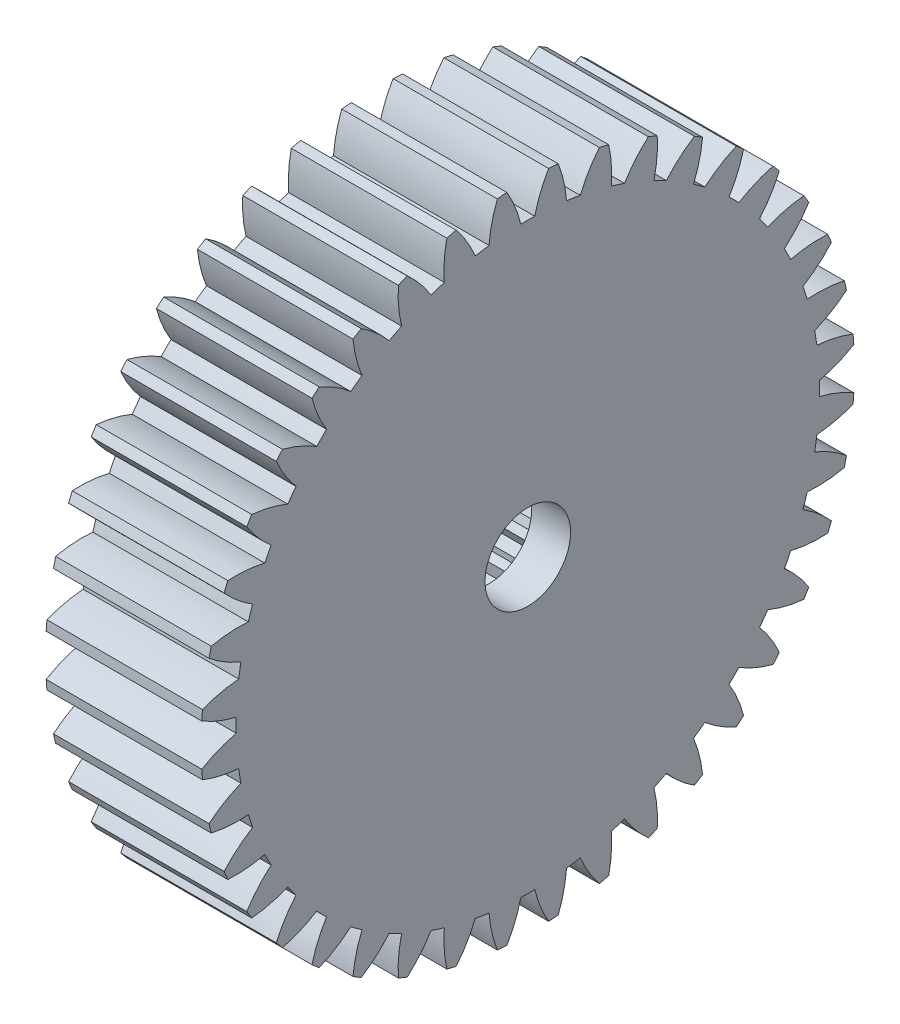
from build123d import *

# Parameters (mm, degrees)
SKETCH1_R           = 0.4
BOSS_EXTRUDE1_DEPTH = 3
CUT_EXTRUDE1_DEPTH  = 13.228899958
SKETCH4_R           = 2.15
CUT_EXTRUDE2_DEPTH  = 13.22890012
BOSS_EXTRUDE2_START = 1
BOSS_EXTRUDE2_DEPTH = 1
SKETCH6_R           = 1.1
CUT_EXTRUDE4_DEPTH  = 13.228900267


with BuildPart() as part:
    # Sketch1 → Boss-Extrude1 (new body)
    with BuildSketch(Plane(origin=(-1.595003587, 0, 0), x_dir=(0, 0, -1), z_dir=(1, 0, 0))):
        with BuildLine():
            ThreePointArc((-8.382899086, 0.535726523), (-7.953265869, 0.324118302), (-7.496863358, 0.178999427))
            ThreePointArc((-7.496863358, 0.178999427), (-7.499, 0), (-7.496863358, -0.178999427))
            ThreePointArc((-7.496863358, -0.178999427), (-7.953265869, -0.324118302), (-8.382899086, -0.535726523))
            ThreePointArc((-8.382899086, -0.535726523), (-8.374105603, -0.659056404), (-8.36349778, -0.782243493))
            ThreePointArc((-8.36349778, -0.782243493), (-7.906051242, -0.924037024), (-7.432566209, -0.995972162))
            ThreePointArc((-7.432566209, -0.995972162), (-7.406674866, -1.173102053), (-7.37656285, -1.349563456))
            ThreePointArc((-7.37656285, -1.349563456), (-7.804644696, -1.564292759), (-8.195885596, -1.840505175))
            ThreePointArc((-8.195885596, -1.840505175), (-8.167907331, -1.960941056), (-8.138159402, -2.080952079))
            ThreePointArc((-8.138159402, -2.080952079), (-7.664163394, -2.149439492), (-7.185254613, -2.146419611))
            ThreePointArc((-7.185254613, -2.146419611), (-7.131972816, -2.317318441), (-7.074626883, -2.486896753))
            ThreePointArc((-7.074626883, -2.486896753), (-7.463847268, -2.765949137), (-7.807062202, -3.099964481))
            ThreePointArc((-7.807062202, -3.099964481), (-7.760588073, -3.214540832), (-7.71243253, -3.328420718))
            ThreePointArc((-7.71243253, -3.328420718), (-7.233558408, -3.321915625), (-6.761018202, -3.244015085))
            ThreePointArc((-6.761018202, -3.244015085), (-6.681657925, -3.404474758), (-6.598490123, -3.562994399))
            ThreePointArc((-6.598490123, -3.562994399), (-6.939265149, -3.899498668), (-7.226003026, -4.283092373))
            ThreePointArc((-7.226003026, -4.283092373), (-7.162177381, -4.388987944), (-7.096799973, -4.493932593))
            ThreePointArc((-7.096799973, -4.493932593), (-6.624839207, -4.412595171), (-6.170303084, -4.261732142))
            ThreePointArc((-6.170303084, -4.261732142), (-6.066818441, -4.407801607), (-5.959876638, -4.551359298))
            ThreePointArc((-5.959876638, -4.551359298), (-6.243815291, -4.9370296), (-6.467015673, -5.360756316))
            ThreePointArc((-6.467015673, -5.360756316), (-6.387410111, -5.455363606), (-6.306420647, -5.548788933))
            ThreePointArc((-6.306420647, -5.548788933), (-5.852994478, -5.39462198), (-5.427654626, -5.174511209))
            ThreePointArc((-5.427654626, -5.174511209), (-5.302593752, -5.302593752), (-5.174511209, -5.427654626))
            ThreePointArc((-5.174511209, -5.427654626), (-5.39462198, -5.852994478), (-5.548788933, -6.306420647))
            ThreePointArc((-5.548788933, -6.306420647), (-5.455363606, -6.387410111), (-5.360756316, -6.467015673))
            ThreePointArc((-5.360756316, -6.467015673), (-4.9370296, -6.243815291), (-4.551359298, -5.959876638))
            ThreePointArc((-4.551359298, -5.959876638), (-4.407801607, -6.066818441), (-4.261732142, -6.170303084))
            ThreePointArc((-4.261732142, -6.170303084), (-4.412595171, -6.624839207), (-4.493932593, -7.096799973))
            ThreePointArc((-4.493932593, -7.096799973), (-4.388987944, -7.162177381), (-4.283092373, -7.226003026))
            ThreePointArc((-4.283092373, -7.226003026), (-3.899498668, -6.939265149), (-3.562994399, -6.598490123))
            ThreePointArc((-3.562994399, -6.598490123), (-3.404474758, -6.681657925), (-3.244015085, -6.761018202))
            ThreePointArc((-3.244015085, -6.761018202), (-3.321915625, -7.233558408), (-3.328420718, -7.71243253))
            ThreePointArc((-3.328420718, -7.71243253), (-3.214540832, -7.760588073), (-3.099964481, -7.807062202))
            ThreePointArc((-3.099964481, -7.807062202), (-2.765949137, -7.463847268), (-2.486896753, -7.074626883))
            ThreePointArc((-2.486896753, -7.074626883), (-2.317318441, -7.131972816), (-2.146419611, -7.185254613))
            ThreePointArc((-2.146419611, -7.185254613), (-2.149439492, -7.664163394), (-2.080952079, -8.138159402))
            ThreePointArc((-2.080952079, -8.138159402), (-1.960941056, -8.167907331), (-1.840505175, -8.195885596))
            ThreePointArc((-1.840505175, -8.195885596), (-1.564292759, -7.804644696), (-1.349563456, -7.37656285))
            ThreePointArc((-1.349563456, -7.37656285), (-1.173102053, -7.406674866), (-0.995972162, -7.432566209))
            ThreePointArc((-0.995972162, -7.432566209), (-0.924037024, -7.906051242), (-0.782243493, -8.36349778))
            ThreePointArc((-0.782243493, -8.36349778), (-0.659056404, -8.374105603), (-0.535726523, -8.382899086))
            ThreePointArc((-0.535726523, -8.382899086), (-0.324118302, -7.953265869), (-0.178999427, -7.496863358))
            ThreePointArc((-0.178999427, -7.496863358), (0, -7.499), (0.178999427, -7.496863358))
            ThreePointArc((0.178999427, -7.496863358), (0.324118302, -7.953265869), (0.535726523, -8.382899086))
            ThreePointArc((0.535726523, -8.382899086), (0.659056404, -8.374105603), (0.782243493, -8.36349778))
            ThreePointArc((0.782243493, -8.36349778), (0.924037024, -7.906051242), (0.995972162, -7.432566209))
            ThreePointArc((0.995972162, -7.432566209), (1.173102053, -7.406674866), (1.349563456, -7.37656285))
            ThreePointArc((1.349563456, -7.37656285), (1.564292759, -7.804644696), (1.840505175, -8.195885596))
            ThreePointArc((1.840505175, -8.195885596), (1.960941056, -8.167907331), (2.080952079, -8.138159402))
            ThreePointArc((2.080952079, -8.138159402), (2.149439492, -7.664163394), (2.146419611, -7.185254613))
            ThreePointArc((2.146419611, -7.185254613), (2.317318441, -7.131972816), (2.486896753, -7.074626883))
            ThreePointArc((2.486896753, -7.074626883), (2.765949137, -7.463847268), (3.099964481, -7.807062202))
            ThreePointArc((3.099964481, -7.807062202), (3.214540832, -7.760588073), (3.328420718, -7.71243253))
            ThreePointArc((3.328420718, -7.71243253), (3.321915625, -7.233558408), (3.244015085, -6.761018202))
            ThreePointArc((3.244015085, -6.761018202), (3.404474758, -6.681657925), (3.562994399, -6.598490123))
            ThreePointArc((3.562994399, -6.598490123), (3.899498668, -6.939265149), (4.283092373, -7.226003026))
            ThreePointArc((4.283092373, -7.226003026), (4.388987944, -7.162177381), (4.493932593, -7.096799973))
            ThreePointArc((4.493932593, -7.096799973), (4.412595171, -6.624839207), (4.261732142, -6.170303084))
            ThreePointArc((4.261732142, -6.170303084), (4.407801607, -6.066818441), (4.551359298, -5.959876638))
            ThreePointArc((4.551359298, -5.959876638), (4.9370296, -6.243815291), (5.360756316, -6.467015673))
            ThreePointArc((5.360756316, -6.467015673), (5.455363606, -6.387410111), (5.548788933, -6.306420647))
            ThreePointArc((5.548788933, -6.306420647), (5.39462198, -5.852994478), (5.174511209, -5.427654626))
            ThreePointArc((5.174511209, -5.427654626), (5.302593752, -5.302593752), (5.427654626, -5.174511209))
            ThreePointArc((5.427654626, -5.174511209), (5.852994478, -5.39462198), (6.306420647, -5.548788933))
            ThreePointArc((6.306420647, -5.548788933), (6.387410111, -5.455363606), (6.467015673, -5.360756316))
            ThreePointArc((6.467015673, -5.360756316), (6.243815291, -4.9370296), (5.959876638, -4.551359298))
            ThreePointArc((5.959876638, -4.551359298), (6.066818441, -4.407801607), (6.170303084, -4.261732142))
            ThreePointArc((6.170303084, -4.261732142), (6.624839207, -4.412595171), (7.096799973, -4.493932593))
            ThreePointArc((7.096799973, -4.493932593), (7.162177381, -4.388987944), (7.226003026, -4.283092373))
            ThreePointArc((7.226003026, -4.283092373), (6.939265149, -3.899498668), (6.598490123, -3.562994399))
            ThreePointArc((6.598490123, -3.562994399), (6.681657925, -3.404474758), (6.761018202, -3.244015085))
            ThreePointArc((6.761018202, -3.244015085), (7.233558408, -3.321915625), (7.71243253, -3.328420718))
            ThreePointArc((7.71243253, -3.328420718), (7.760588073, -3.214540832), (7.807062202, -3.099964481))
            ThreePointArc((7.807062202, -3.099964481), (7.463847268, -2.765949137), (7.074626883, -2.486896753))
            ThreePointArc((7.074626883, -2.486896753), (7.131972816, -2.317318441), (7.185254613, -2.146419611))
            ThreePointArc((7.185254613, -2.146419611), (7.664163394, -2.149439492), (8.138159402, -2.080952079))
            ThreePointArc((8.138159402, -2.080952079), (8.167907331, -1.960941056), (8.195885596, -1.840505175))
            ThreePointArc((8.195885596, -1.840505175), (7.804644696, -1.564292759), (7.37656285, -1.349563456))
            ThreePointArc((7.37656285, -1.349563456), (7.406674866, -1.173102053), (7.432566209, -0.995972162))
            ThreePointArc((7.432566209, -0.995972162), (7.906051242, -0.924037024), (8.36349778, -0.782243493))
            ThreePointArc((8.36349778, -0.782243493), (8.374105603, -0.659056404), (8.382899086, -0.535726523))
            ThreePointArc((8.382899086, -0.535726523), (7.953265869, -0.324118302), (7.496863358, -0.178999427))
            ThreePointArc((7.496863358, -0.178999427), (7.499, 0), (7.496863358, 0.178999427))
            ThreePointArc((7.496863358, 0.178999427), (7.953265869, 0.324118302), (8.382899086, 0.535726523))
            ThreePointArc((8.382899086, 0.535726523), (8.374105603, 0.659056404), (8.36349778, 0.782243493))
            ThreePointArc((8.36349778, 0.782243493), (7.906051242, 0.924037024), (7.432566209, 0.995972162))
            ThreePointArc((7.432566209, 0.995972162), (7.406674866, 1.173102053), (7.37656285, 1.349563456))
            ThreePointArc((7.37656285, 1.349563456), (7.804644696, 1.564292759), (8.195885596, 1.840505175))
            ThreePointArc((8.195885596, 1.840505175), (8.167907331, 1.960941056), (8.138159402, 2.080952079))
            ThreePointArc((8.138159402, 2.080952079), (7.664163394, 2.149439492), (7.185254613, 2.146419611))
            ThreePointArc((7.185254613, 2.146419611), (7.131972816, 2.317318441), (7.074626883, 2.486896753))
            ThreePointArc((7.074626883, 2.486896753), (7.463847268, 2.765949137), (7.807062202, 3.099964481))
            ThreePointArc((7.807062202, 3.099964481), (7.760588073, 3.214540832), (7.71243253, 3.328420718))
            ThreePointArc((7.71243253, 3.328420718), (7.233558408, 3.321915625), (6.761018202, 3.244015085))
            ThreePointArc((6.761018202, 3.244015085), (6.681657925, 3.404474758), (6.598490123, 3.562994399))
            ThreePointArc((6.598490123, 3.562994399), (6.939265149, 3.899498668), (7.226003026, 4.283092373))
            ThreePointArc((7.226003026, 4.283092373), (7.162177381, 4.388987944), (7.096799973, 4.493932593))
            ThreePointArc((7.096799973, 4.493932593), (6.624839207, 4.412595171), (6.170303084, 4.261732142))
            ThreePointArc((6.170303084, 4.261732142), (6.066818441, 4.407801607), (5.959876638, 4.551359298))
            ThreePointArc((5.959876638, 4.551359298), (6.243815291, 4.9370296), (6.467015673, 5.360756316))
            ThreePointArc((6.467015673, 5.360756316), (6.387410111, 5.455363606), (6.306420647, 5.548788933))
            ThreePointArc((6.306420647, 5.548788933), (5.852994478, 5.39462198), (5.427654626, 5.174511209))
            ThreePointArc((5.427654626, 5.174511209), (5.302593752, 5.302593752), (5.174511209, 5.427654626))
            ThreePointArc((5.174511209, 5.427654626), (5.39462198, 5.852994478), (5.548788933, 6.306420647))
            ThreePointArc((5.548788933, 6.306420647), (5.455363606, 6.387410111), (5.360756316, 6.467015673))
            ThreePointArc((5.360756316, 6.467015673), (4.9370296, 6.243815291), (4.551359298, 5.959876638))
            ThreePointArc((4.551359298, 5.959876638), (4.407801607, 6.066818441), (4.261732142, 6.170303084))
            ThreePointArc((4.261732142, 6.170303084), (4.412595171, 6.624839207), (4.493932593, 7.096799973))
            ThreePointArc((4.493932593, 7.096799973), (4.388987944, 7.162177381), (4.283092373, 7.226003026))
            ThreePointArc((4.283092373, 7.226003026), (3.899498668, 6.939265149), (3.562994399, 6.598490123))
            ThreePointArc((3.562994399, 6.598490123), (3.404474758, 6.681657925), (3.244015085, 6.761018202))
            ThreePointArc((3.244015085, 6.761018202), (3.321915625, 7.233558408), (3.328420718, 7.71243253))
            ThreePointArc((3.328420718, 7.71243253), (3.214540832, 7.760588073), (3.099964481, 7.807062202))
            ThreePointArc((3.099964481, 7.807062202), (2.765949137, 7.463847268), (2.486896753, 7.074626883))
            ThreePointArc((2.486896753, 7.074626883), (2.317318441, 7.131972816), (2.146419611, 7.185254613))
            ThreePointArc((2.146419611, 7.185254613), (2.149439492, 7.664163394), (2.080952079, 8.138159402))
            ThreePointArc((2.080952079, 8.138159402), (1.960941056, 8.167907331), (1.840505175, 8.195885596))
            ThreePointArc((1.840505175, 8.195885596), (1.564292759, 7.804644696), (1.349563456, 7.37656285))
            ThreePointArc((1.349563456, 7.37656285), (1.173102053, 7.406674866), (0.995972162, 7.432566209))
            ThreePointArc((0.995972162, 7.432566209), (0.924037024, 7.906051242), (0.782243493, 8.36349778))
            ThreePointArc((0.782243493, 8.36349778), (0.659056404, 8.374105603), (0.535726523, 8.382899086))
            ThreePointArc((0.535726523, 8.382899086), (0.324118302, 7.953265869), (0.178999427, 7.496863358))
            ThreePointArc((0.178999427, 7.496863358), (0, 7.499), (-0.178999427, 7.496863358))
            ThreePointArc((-0.178999427, 7.496863358), (-0.324118302, 7.953265869), (-0.535726523, 8.382899086))
            ThreePointArc((-0.535726523, 8.382899086), (-0.659056404, 8.374105603), (-0.782243493, 8.36349778))
            ThreePointArc((-0.782243493, 8.36349778), (-0.924037024, 7.906051242), (-0.995972162, 7.432566209))
            ThreePointArc((-0.995972162, 7.432566209), (-1.173102053, 7.406674866), (-1.349563456, 7.37656285))
            ThreePointArc((-1.349563456, 7.37656285), (-1.564292759, 7.804644696), (-1.840505175, 8.195885596))
            ThreePointArc((-1.840505175, 8.195885596), (-1.960941056, 8.167907331), (-2.080952079, 8.138159402))
            ThreePointArc((-2.080952079, 8.138159402), (-2.149439492, 7.664163394), (-2.146419611, 7.185254613))
            ThreePointArc((-2.146419611, 7.185254613), (-2.317318441, 7.131972816), (-2.486896753, 7.074626883))
            ThreePointArc((-2.486896753, 7.074626883), (-2.765949137, 7.463847268), (-3.099964481, 7.807062202))
            ThreePointArc((-3.099964481, 7.807062202), (-3.214540832, 7.760588073), (-3.328420718, 7.71243253))
            ThreePointArc((-3.328420718, 7.71243253), (-3.321915625, 7.233558408), (-3.244015085, 6.761018202))
            ThreePointArc((-3.244015085, 6.761018202), (-3.404474758, 6.681657925), (-3.562994399, 6.598490123))
            ThreePointArc((-3.562994399, 6.598490123), (-3.899498668, 6.939265149), (-4.283092373, 7.226003026))
            ThreePointArc((-4.283092373, 7.226003026), (-4.388987944, 7.162177381), (-4.493932593, 7.096799973))
            ThreePointArc((-4.493932593, 7.096799973), (-4.412595171, 6.624839207), (-4.261732142, 6.170303084))
            ThreePointArc((-4.261732142, 6.170303084), (-4.407801607, 6.066818441), (-4.551359298, 5.959876638))
            ThreePointArc((-4.551359298, 5.959876638), (-4.9370296, 6.243815291), (-5.360756316, 6.467015673))
            ThreePointArc((-5.360756316, 6.467015673), (-5.455363606, 6.387410111), (-5.548788933, 6.306420647))
            ThreePointArc((-5.548788933, 6.306420647), (-5.39462198, 5.852994478), (-5.174511209, 5.427654626))
            ThreePointArc((-5.174511209, 5.427654626), (-5.302593752, 5.302593752), (-5.427654626, 5.174511209))
            ThreePointArc((-5.427654626, 5.174511209), (-5.852994478, 5.39462198), (-6.306420647, 5.548788933))
            ThreePointArc((-6.306420647, 5.548788933), (-6.387410111, 5.455363606), (-6.467015673, 5.360756316))
            ThreePointArc((-6.467015673, 5.360756316), (-6.243815291, 4.9370296), (-5.959876638, 4.551359298))
            ThreePointArc((-5.959876638, 4.551359298), (-6.066818441, 4.407801607), (-6.170303084, 4.261732142))
            ThreePointArc((-6.170303084, 4.261732142), (-6.624839207, 4.412595171), (-7.096799973, 4.493932593))
            ThreePointArc((-7.096799973, 4.493932593), (-7.162177381, 4.388987944), (-7.226003026, 4.283092373))
            ThreePointArc((-7.226003026, 4.283092373), (-6.939265149, 3.899498668), (-6.598490123, 3.562994399))
            ThreePointArc((-6.598490123, 3.562994399), (-6.681657925, 3.404474758), (-6.761018202, 3.244015085))
            ThreePointArc((-6.761018202, 3.244015085), (-7.233558408, 3.321915625), (-7.71243253, 3.328420718))
            ThreePointArc((-7.71243253, 3.328420718), (-7.760588073, 3.214540832), (-7.807062202, 3.099964481))
            ThreePointArc((-7.807062202, 3.099964481), (-7.463847268, 2.765949137), (-7.074626883, 2.486896753))
            ThreePointArc((-7.074626883, 2.486896753), (-7.131972816, 2.317318441), (-7.185254613, 2.146419611))
            ThreePointArc((-7.185254613, 2.146419611), (-7.664163394, 2.149439492), (-8.138159402, 2.080952079))
            ThreePointArc((-8.138159402, 2.080952079), (-8.167907331, 1.960941056), (-8.195885596, 1.840505175))
            ThreePointArc((-8.195885596, 1.840505175), (-7.804644696, 1.564292759), (-7.37656285, 1.349563456))
            ThreePointArc((-7.37656285, 1.349563456), (-7.406674866, 1.173102053), (-7.432566209, 0.995972162))
            ThreePointArc((-7.432566209, 0.995972162), (-7.906051242, 0.924037024), (-8.36349778, 0.782243493))
            ThreePointArc((-8.36349778, 0.782243493), (-8.374105603, 0.659056404), (-8.382899086, 0.535726523))
        make_face()
        Circle(SKETCH1_R, mode=Mode.SUBTRACT)
    extrude(amount=-BOSS_EXTRUDE1_DEPTH)

    # Sketch2 → Cut-Extrude1 (cut, through all)
    with BuildSketch(Plane(origin=(-1.595003587, 0, 0), x_dir=(0, 0, -1), z_dir=(1, 0, 0))):
        with BuildLine():
            add(Edge.make_bspline(
                [(-2.437211521, 0.25), (-2.351793786, 0.206143264), (-2.189999835, 0.123072054), (-2.026962952, 0.039466646), (-1.95, 0)],
                knots=[0, 0, 0, 0, 0.527941467, 1, 1, 1, 1], degree=3))
            add(Edge.make_bspline(
                [(-1.95, 0), (-2.026962952, -0.039466646), (-2.189999835, -0.123072054), (-2.351793786, -0.206143264), (-2.437211521, -0.25)],
                knots=[0, 0, 0, 0, 0.472058533, 1, 1, 1, 1], degree=3))
            ThreePointArc((-2.437211521, -0.25), (-2.419836434, -0.383264439), (-2.395180148, -0.51537565))
            add(Edge.make_bspline(
                [(-2.395180148, -0.51537565), (-2.300390577, -0.530690353), (-2.12084497, -0.559698688), (-1.939952188, -0.588830988), (-1.854560207, -0.602583139)],
                knots=[0, 0, 0, 0, 0.527941467, 1, 1, 1, 1], degree=3))
            add(Edge.make_bspline(
                [(-1.854560207, -0.602583139), (-1.915560459, -0.66390101), (-2.044782258, -0.793795646), (-2.172987033, -0.922798141), (-2.24067165, -0.990903908)],
                knots=[0, 0, 0, 0, 0.472058533, 1, 1, 1, 1], degree=3))
            ThreePointArc((-2.24067165, -0.990903908), (-2.182965984, -1.112276724), (-2.118691853, -1.23030274))
            add(Edge.make_bspline(
                [(-2.118691853, -1.23030274), (-2.02380911, -1.2155763), (-1.844087023, -1.187682223), (-1.663045388, -1.159489743), (-1.577583139, -1.146181242)],
                knots=[0, 0, 0, 0, 0.527941467, 1, 1, 1, 1], degree=3))
            add(Edge.make_bspline(
                [(-1.577583139, -1.146181242), (-1.616649563, -1.223348118), (-1.699407146, -1.386816989), (-1.78147317, -1.549123107), (-1.824799227, -1.634811238)],
                knots=[0, 0, 0, 0, 0.472058533, 1, 1, 1, 1], degree=3))
            ThreePointArc((-1.824799227, -1.634811238), (-1.732411614, -1.732411614), (-1.634811238, -1.824799227))
            add(Edge.make_bspline(
                [(-1.634811238, -1.824799227), (-1.549123107, -1.78147317), (-1.386816989, -1.699407146), (-1.223348118, -1.616649563), (-1.146181242, -1.577583139)],
                knots=[0, 0, 0, 0, 0.527941467, 1, 1, 1, 1], degree=3))
            add(Edge.make_bspline(
                [(-1.146181242, -1.577583139), (-1.159489743, -1.663045388), (-1.187682223, -1.844087023), (-1.2155763, -2.02380911), (-1.23030274, -2.118691853)],
                knots=[0, 0, 0, 0, 0.472058533, 1, 1, 1, 1], degree=3))
            ThreePointArc((-1.23030274, -2.118691853), (-1.112276724, -2.182965984), (-0.990903908, -2.24067165))
            add(Edge.make_bspline(
                [(-0.990903908, -2.24067165), (-0.922798141, -2.172987033), (-0.793795646, -2.044782258), (-0.66390101, -1.915560459), (-0.602583139, -1.854560207)],
                knots=[0, 0, 0, 0, 0.527941467, 1, 1, 1, 1], degree=3))
            add(Edge.make_bspline(
                [(-0.602583139, -1.854560207), (-0.588830988, -1.939952188), (-0.559698688, -2.12084497), (-0.530690353, -2.300390577), (-0.51537565, -2.395180148)],
                knots=[0, 0, 0, 0, 0.472058533, 1, 1, 1, 1], degree=3))
            ThreePointArc((-0.51537565, -2.395180148), (-0.383264439, -2.419836434), (-0.25, -2.437211521))
            add(Edge.make_bspline(
                [(-0.25, -2.437211521), (-0.206143264, -2.351793786), (-0.123072054, -2.189999835), (-0.039466646, -2.026962952), (0, -1.95)],
                knots=[0, 0, 0, 0, 0.527941467, 1, 1, 1, 1], degree=3))
            add(Edge.make_bspline(
                [(0, -1.95), (0.039466646, -2.026962952), (0.123072054, -2.189999835), (0.206143264, -2.351793786), (0.25, -2.437211521)],
                knots=[0, 0, 0, 0, 0.472058533, 1, 1, 1, 1], degree=3))
            ThreePointArc((0.25, -2.437211521), (0.383264439, -2.419836434), (0.51537565, -2.395180148))
            add(Edge.make_bspline(
                [(0.51537565, -2.395180148), (0.530690353, -2.300390577), (0.559698688, -2.12084497), (0.588830988, -1.939952188), (0.602583139, -1.854560207)],
                knots=[0, 0, 0, 0, 0.527941467, 1, 1, 1, 1], degree=3))
            add(Edge.make_bspline(
                [(0.602583139, -1.854560207), (0.66390101, -1.915560459), (0.793795646, -2.044782258), (0.922798141, -2.172987033), (0.990903908, -2.24067165)],
                knots=[0, 0, 0, 0, 0.472058533, 1, 1, 1, 1], degree=3))
            ThreePointArc((0.990903908, -2.24067165), (1.112276724, -2.182965984), (1.23030274, -2.118691853))
            add(Edge.make_bspline(
                [(1.23030274, -2.118691853), (1.2155763, -2.02380911), (1.187682223, -1.844087023), (1.159489743, -1.663045388), (1.146181242, -1.577583139)],
                knots=[0, 0, 0, 0, 0.527941467, 1, 1, 1, 1], degree=3))
            add(Edge.make_bspline(
                [(1.146181242, -1.577583139), (1.223348118, -1.616649563), (1.386816989, -1.699407146), (1.549123107, -1.78147317), (1.634811238, -1.824799227)],
                knots=[0, 0, 0, 0, 0.472058533, 1, 1, 1, 1], degree=3))
            ThreePointArc((1.634811238, -1.824799227), (1.732411614, -1.732411614), (1.824799227, -1.634811238))
            add(Edge.make_bspline(
                [(1.824799227, -1.634811238), (1.78147317, -1.549123107), (1.699407146, -1.386816989), (1.616649563, -1.223348118), (1.577583139, -1.146181242)],
                knots=[0, 0, 0, 0, 0.527941467, 1, 1, 1, 1], degree=3))
            add(Edge.make_bspline(
                [(1.577583139, -1.146181242), (1.663045388, -1.159489743), (1.844087023, -1.187682223), (2.02380911, -1.2155763), (2.118691853, -1.23030274)],
                knots=[0, 0, 0, 0, 0.472058533, 1, 1, 1, 1], degree=3))
            ThreePointArc((2.118691853, -1.23030274), (2.182965984, -1.112276724), (2.24067165, -0.990903908))
            add(Edge.make_bspline(
                [(2.24067165, -0.990903908), (2.172987033, -0.922798141), (2.044782258, -0.793795646), (1.915560459, -0.66390101), (1.854560207, -0.602583139)],
                knots=[0, 0, 0, 0, 0.527941467, 1, 1, 1, 1], degree=3))
            add(Edge.make_bspline(
                [(1.854560207, -0.602583139), (1.939952188, -0.588830988), (2.12084497, -0.559698688), (2.300390577, -0.530690353), (2.395180148, -0.51537565)],
                knots=[0, 0, 0, 0, 0.472058533, 1, 1, 1, 1], degree=3))
            ThreePointArc((2.395180148, -0.51537565), (2.419836434, -0.383264439), (2.437211521, -0.25))
            add(Edge.make_bspline(
                [(2.437211521, -0.25), (2.351793786, -0.206143264), (2.189999835, -0.123072054), (2.026962952, -0.039466646), (1.95, 0)],
                knots=[0, 0, 0, 0, 0.527941467, 1, 1, 1, 1], degree=3))
            add(Edge.make_bspline(
                [(1.95, 0), (2.026962952, 0.039466646), (2.189999835, 0.123072054), (2.351793786, 0.206143264), (2.437211521, 0.25)],
                knots=[0, 0, 0, 0, 0.472058533, 1, 1, 1, 1], degree=3))
            ThreePointArc((2.437211521, 0.25), (2.419836434, 0.383264439), (2.395180148, 0.51537565))
            add(Edge.make_bspline(
                [(2.395180148, 0.51537565), (2.300390577, 0.530690353), (2.12084497, 0.559698688), (1.939952188, 0.588830988), (1.854560207, 0.602583139)],
                knots=[0, 0, 0, 0, 0.527941467, 1, 1, 1, 1], degree=3))
            add(Edge.make_bspline(
                [(1.854560207, 0.602583139), (1.915560459, 0.66390101), (2.044782258, 0.793795646), (2.172987033, 0.922798141), (2.24067165, 0.990903908)],
                knots=[0, 0, 0, 0, 0.472058533, 1, 1, 1, 1], degree=3))
            ThreePointArc((2.24067165, 0.990903908), (2.182965984, 1.112276724), (2.118691853, 1.23030274))
            add(Edge.make_bspline(
                [(2.118691853, 1.23030274), (2.02380911, 1.2155763), (1.844087023, 1.187682223), (1.663045388, 1.159489743), (1.577583139, 1.146181242)],
                knots=[0, 0, 0, 0, 0.527941467, 1, 1, 1, 1], degree=3))
            add(Edge.make_bspline(
                [(1.577583139, 1.146181242), (1.616649563, 1.223348118), (1.699407146, 1.386816989), (1.78147317, 1.549123107), (1.824799227, 1.634811238)],
                knots=[0, 0, 0, 0, 0.472058533, 1, 1, 1, 1], degree=3))
            ThreePointArc((1.824799227, 1.634811238), (1.732411614, 1.732411614), (1.634811238, 1.824799227))
            add(Edge.make_bspline(
                [(1.634811238, 1.824799227), (1.549123107, 1.78147317), (1.386816989, 1.699407146), (1.223348118, 1.616649563), (1.146181242, 1.577583139)],
                knots=[0, 0, 0, 0, 0.527941467, 1, 1, 1, 1], degree=3))
            add(Edge.make_bspline(
                [(1.146181242, 1.577583139), (1.159489743, 1.663045388), (1.187682223, 1.844087023), (1.2155763, 2.02380911), (1.23030274, 2.118691853)],
                knots=[0, 0, 0, 0, 0.472058533, 1, 1, 1, 1], degree=3))
            ThreePointArc((1.23030274, 2.118691853), (1.112276724, 2.182965984), (0.990903908, 2.24067165))
            add(Edge.make_bspline(
                [(0.990903908, 2.24067165), (0.922798141, 2.172987033), (0.793795646, 2.044782258), (0.66390101, 1.915560459), (0.602583139, 1.854560207)],
                knots=[0, 0, 0, 0, 0.527941467, 1, 1, 1, 1], degree=3))
            add(Edge.make_bspline(
                [(0.602583139, 1.854560207), (0.588830988, 1.939952188), (0.559698688, 2.12084497), (0.530690353, 2.300390577), (0.51537565, 2.395180148)],
                knots=[0, 0, 0, 0, 0.472058533, 1, 1, 1, 1], degree=3))
            ThreePointArc((0.51537565, 2.395180148), (0.383264439, 2.419836434), (0.25, 2.437211521))
            add(Edge.make_bspline(
                [(0.25, 2.437211521), (0.206143264, 2.351793786), (0.123072054, 2.189999835), (0.039466646, 2.026962952), (0, 1.95)],
                knots=[0, 0, 0, 0, 0.527941467, 1, 1, 1, 1], degree=3))
            add(Edge.make_bspline(
                [(0, 1.95), (-0.039466646, 2.026962952), (-0.123072054, 2.189999835), (-0.206143264, 2.351793786), (-0.25, 2.437211521)],
                knots=[0, 0, 0, 0, 0.472058533, 1, 1, 1, 1], degree=3))
            ThreePointArc((-0.25, 2.437211521), (-0.383264439, 2.419836434), (-0.51537565, 2.395180148))
            add(Edge.make_bspline(
                [(-0.51537565, 2.395180148), (-0.530690353, 2.300390577), (-0.559698688, 2.12084497), (-0.588830988, 1.939952188), (-0.602583139, 1.854560207)],
                knots=[0, 0, 0, 0, 0.527941467, 1, 1, 1, 1], degree=3))
            add(Edge.make_bspline(
                [(-0.602583139, 1.854560207), (-0.66390101, 1.915560459), (-0.793795646, 2.044782258), (-0.922798141, 2.172987033), (-0.990903908, 2.24067165)],
                knots=[0, 0, 0, 0, 0.472058533, 1, 1, 1, 1], degree=3))
            ThreePointArc((-0.990903908, 2.24067165), (-1.112276724, 2.182965984), (-1.23030274, 2.118691853))
            add(Edge.make_bspline(
                [(-1.23030274, 2.118691853), (-1.2155763, 2.02380911), (-1.187682223, 1.844087023), (-1.159489743, 1.663045388), (-1.146181242, 1.577583139)],
                knots=[0, 0, 0, 0, 0.527941467, 1, 1, 1, 1], degree=3))
            add(Edge.make_bspline(
                [(-1.146181242, 1.577583139), (-1.223348118, 1.616649563), (-1.386816989, 1.699407146), (-1.549123107, 1.78147317), (-1.634811238, 1.824799227)],
                knots=[0, 0, 0, 0, 0.472058533, 1, 1, 1, 1], degree=3))
            ThreePointArc((-1.634811238, 1.824799227), (-1.732411614, 1.732411614), (-1.824799227, 1.634811238))
            add(Edge.make_bspline(
                [(-1.824799227, 1.634811238), (-1.78147317, 1.549123107), (-1.699407146, 1.386816989), (-1.616649563, 1.223348118), (-1.577583139, 1.146181242)],
                knots=[0, 0, 0, 0, 0.527941467, 1, 1, 1, 1], degree=3))
            add(Edge.make_bspline(
                [(-1.577583139, 1.146181242), (-1.663045388, 1.159489743), (-1.844087023, 1.187682223), (-2.02380911, 1.2155763), (-2.118691853, 1.23030274)],
                knots=[0, 0, 0, 0, 0.472058533, 1, 1, 1, 1], degree=3))
            ThreePointArc((-2.118691853, 1.23030274), (-2.182965984, 1.112276724), (-2.24067165, 0.990903908))
            add(Edge.make_bspline(
                [(-2.24067165, 0.990903908), (-2.172987033, 0.922798141), (-2.044782258, 0.793795646), (-1.915560459, 0.66390101), (-1.854560207, 0.602583139)],
                knots=[0, 0, 0, 0, 0.527941467, 1, 1, 1, 1], degree=3))
            add(Edge.make_bspline(
                [(-1.854560207, 0.602583139), (-1.939952188, 0.588830988), (-2.12084497, 0.559698688), (-2.300390577, 0.530690353), (-2.395180148, 0.51537565)],
                knots=[0, 0, 0, 0, 0.472058533, 1, 1, 1, 1], degree=3))
            ThreePointArc((-2.395180148, 0.51537565), (-2.419836434, 0.383264439), (-2.437211521, 0.25))
        make_face()
    extrude(amount=-CUT_EXTRUDE1_DEPTH, mode=Mode.SUBTRACT)

    # Sketch4 → Cut-Extrude2 (cut, through all)
    with BuildSketch(Plane(origin=(-1.595003587, 0, 0), x_dir=(0, 0, -1), z_dir=(1, 0, 0))):
        Circle(SKETCH4_R)
    extrude(amount=-CUT_EXTRUDE2_DEPTH, mode=Mode.SUBTRACT)

    # Sketch5 → Boss-Extrude2 (add)
    with BuildSketch(Plane(origin=(-1.595003587, 0, 0), x_dir=(0, 0, -1), z_dir=(1, 0, 0)).offset(BOSS_EXTRUDE2_START)):
        with BuildLine():
            ThreePointArc((-8.36349778, 0.782243493), (-8.374105603, 0.659056404), (-8.382899086, 0.535726523))
            ThreePointArc((-8.382899086, 0.535726523), (-7.953265869, 0.324118302), (-7.496863358, 0.178999427))
            ThreePointArc((-7.496863358, 0.178999427), (-7.499, 0), (-7.496863358, -0.178999427))
            ThreePointArc((-7.496863358, -0.178999427), (-7.953265869, -0.324118302), (-8.382899086, -0.535726523))
            ThreePointArc((-8.382899086, -0.535726523), (-8.374105603, -0.659056404), (-8.36349778, -0.782243493))
            ThreePointArc((-8.36349778, -0.782243493), (-7.906051242, -0.924037024), (-7.432566209, -0.995972162))
            ThreePointArc((-7.432566209, -0.995972162), (-7.406674866, -1.173102053), (-7.37656285, -1.349563456))
            ThreePointArc((-7.37656285, -1.349563456), (-7.804644696, -1.564292759), (-8.195885596, -1.840505175))
            ThreePointArc((-8.195885596, -1.840505175), (-8.167907331, -1.960941056), (-8.138159402, -2.080952079))
            ThreePointArc((-8.138159402, -2.080952079), (-7.664163394, -2.149439492), (-7.185254613, -2.146419611))
            ThreePointArc((-7.185254613, -2.146419611), (-7.131972816, -2.317318441), (-7.074626883, -2.486896753))
            ThreePointArc((-7.074626883, -2.486896753), (-7.463847268, -2.765949137), (-7.807062202, -3.099964481))
            ThreePointArc((-7.807062202, -3.099964481), (-7.760588073, -3.214540832), (-7.71243253, -3.328420718))
            ThreePointArc((-7.71243253, -3.328420718), (-7.233558408, -3.321915625), (-6.761018202, -3.244015085))
            ThreePointArc((-6.761018202, -3.244015085), (-6.681657925, -3.404474758), (-6.598490123, -3.562994399))
            ThreePointArc((-6.598490123, -3.562994399), (-6.939265149, -3.899498668), (-7.226003026, -4.283092373))
            ThreePointArc((-7.226003026, -4.283092373), (-7.162177381, -4.388987944), (-7.096799973, -4.493932593))
            ThreePointArc((-7.096799973, -4.493932593), (-6.624839207, -4.412595171), (-6.170303084, -4.261732142))
            ThreePointArc((-6.170303084, -4.261732142), (-6.066818441, -4.407801607), (-5.959876638, -4.551359298))
            ThreePointArc((-5.959876638, -4.551359298), (-6.243815291, -4.9370296), (-6.467015673, -5.360756316))
            ThreePointArc((-6.467015673, -5.360756316), (-6.387410111, -5.455363606), (-6.306420647, -5.548788933))
            ThreePointArc((-6.306420647, -5.548788933), (-5.852994478, -5.39462198), (-5.427654626, -5.174511209))
            ThreePointArc((-5.427654626, -5.174511209), (-5.302593752, -5.302593752), (-5.174511209, -5.427654626))
            ThreePointArc((-5.174511209, -5.427654626), (-5.39462198, -5.852994478), (-5.548788933, -6.306420647))
            ThreePointArc((-5.548788933, -6.306420647), (-5.455363606, -6.387410111), (-5.360756316, -6.467015673))
            ThreePointArc((-5.360756316, -6.467015673), (-4.9370296, -6.243815291), (-4.551359298, -5.959876638))
            ThreePointArc((-4.551359298, -5.959876638), (-4.407801607, -6.066818441), (-4.261732142, -6.170303084))
            ThreePointArc((-4.261732142, -6.170303084), (-4.412595171, -6.624839207), (-4.493932593, -7.096799973))
            ThreePointArc((-4.493932593, -7.096799973), (-4.388987944, -7.162177381), (-4.283092373, -7.226003026))
            ThreePointArc((-4.283092373, -7.226003026), (-3.899498668, -6.939265149), (-3.562994399, -6.598490123))
            ThreePointArc((-3.562994399, -6.598490123), (-3.404474758, -6.681657925), (-3.244015085, -6.761018202))
            ThreePointArc((-3.244015085, -6.761018202), (-3.321915625, -7.233558408), (-3.328420718, -7.71243253))
            ThreePointArc((-3.328420718, -7.71243253), (-3.214540832, -7.760588073), (-3.099964481, -7.807062202))
            ThreePointArc((-3.099964481, -7.807062202), (-2.765949137, -7.463847268), (-2.486896753, -7.074626883))
            ThreePointArc((-2.486896753, -7.074626883), (-2.317318441, -7.131972816), (-2.146419611, -7.185254613))
            ThreePointArc((-2.146419611, -7.185254613), (-2.149439492, -7.664163394), (-2.080952079, -8.138159402))
            ThreePointArc((-2.080952079, -8.138159402), (-1.960941056, -8.167907331), (-1.840505175, -8.195885596))
            ThreePointArc((-1.840505175, -8.195885596), (-1.564292759, -7.804644696), (-1.349563456, -7.37656285))
            ThreePointArc((-1.349563456, -7.37656285), (-1.173102053, -7.406674866), (-0.995972162, -7.432566209))
            ThreePointArc((-0.995972162, -7.432566209), (-0.924037024, -7.906051242), (-0.782243493, -8.36349778))
            ThreePointArc((-0.782243493, -8.36349778), (-0.659056404, -8.374105603), (-0.535726523, -8.382899086))
            ThreePointArc((-0.535726523, -8.382899086), (-0.324118302, -7.953265869), (-0.178999427, -7.496863358))
            ThreePointArc((-0.178999427, -7.496863358), (0, -7.499), (0.178999427, -7.496863358))
            ThreePointArc((0.178999427, -7.496863358), (0.324118302, -7.953265869), (0.535726523, -8.382899086))
            ThreePointArc((0.535726523, -8.382899086), (0.659056404, -8.374105603), (0.782243493, -8.36349778))
            ThreePointArc((0.782243493, -8.36349778), (0.924037024, -7.906051242), (0.995972162, -7.432566209))
            ThreePointArc((0.995972162, -7.432566209), (1.173102053, -7.406674866), (1.349563456, -7.37656285))
            ThreePointArc((1.349563456, -7.37656285), (1.564292759, -7.804644696), (1.840505175, -8.195885596))
            ThreePointArc((1.840505175, -8.195885596), (1.960941056, -8.167907331), (2.080952079, -8.138159402))
            ThreePointArc((2.080952079, -8.138159402), (2.149439492, -7.664163394), (2.146419611, -7.185254613))
            ThreePointArc((2.146419611, -7.185254613), (2.317318441, -7.131972816), (2.486896753, -7.074626883))
            ThreePointArc((2.486896753, -7.074626883), (2.765949137, -7.463847268), (3.099964481, -7.807062202))
            ThreePointArc((3.099964481, -7.807062202), (3.214540832, -7.760588073), (3.328420718, -7.71243253))
            ThreePointArc((3.328420718, -7.71243253), (3.321915625, -7.233558408), (3.244015085, -6.761018202))
            ThreePointArc((3.244015085, -6.761018202), (3.404474758, -6.681657925), (3.562994399, -6.598490123))
            ThreePointArc((3.562994399, -6.598490123), (3.899498668, -6.939265149), (4.283092373, -7.226003026))
            ThreePointArc((4.283092373, -7.226003026), (4.388987944, -7.162177381), (4.493932593, -7.096799973))
            ThreePointArc((4.493932593, -7.096799973), (4.412595171, -6.624839207), (4.261732142, -6.170303084))
            ThreePointArc((4.261732142, -6.170303084), (4.407801607, -6.066818441), (4.551359298, -5.959876638))
            ThreePointArc((4.551359298, -5.959876638), (4.9370296, -6.243815291), (5.360756316, -6.467015673))
            ThreePointArc((5.360756316, -6.467015673), (5.455363606, -6.387410111), (5.548788933, -6.306420647))
            ThreePointArc((5.548788933, -6.306420647), (5.39462198, -5.852994478), (5.174511209, -5.427654626))
            ThreePointArc((5.174511209, -5.427654626), (5.302593752, -5.302593752), (5.427654626, -5.174511209))
            ThreePointArc((5.427654626, -5.174511209), (5.852994478, -5.39462198), (6.306420647, -5.548788933))
            ThreePointArc((6.306420647, -5.548788933), (6.387410111, -5.455363606), (6.467015673, -5.360756316))
            ThreePointArc((6.467015673, -5.360756316), (6.243815291, -4.9370296), (5.959876638, -4.551359298))
            ThreePointArc((5.959876638, -4.551359298), (6.066818441, -4.407801607), (6.170303084, -4.261732142))
            ThreePointArc((6.170303084, -4.261732142), (6.624839207, -4.412595171), (7.096799973, -4.493932593))
            ThreePointArc((7.096799973, -4.493932593), (7.162177381, -4.388987944), (7.226003026, -4.283092373))
            ThreePointArc((7.226003026, -4.283092373), (6.939265149, -3.899498668), (6.598490123, -3.562994399))
            ThreePointArc((6.598490123, -3.562994399), (6.681657925, -3.404474758), (6.761018202, -3.244015085))
            ThreePointArc((6.761018202, -3.244015085), (7.233558408, -3.321915625), (7.71243253, -3.328420718))
            ThreePointArc((7.71243253, -3.328420718), (7.760588073, -3.214540832), (7.807062202, -3.099964481))
            ThreePointArc((7.807062202, -3.099964481), (7.463847268, -2.765949137), (7.074626883, -2.486896753))
            ThreePointArc((7.074626883, -2.486896753), (7.131972816, -2.317318441), (7.185254613, -2.146419611))
            ThreePointArc((7.185254613, -2.146419611), (7.664163394, -2.149439492), (8.138159402, -2.080952079))
            ThreePointArc((8.138159402, -2.080952079), (8.167907331, -1.960941056), (8.195885596, -1.840505175))
            ThreePointArc((8.195885596, -1.840505175), (7.804644696, -1.564292759), (7.37656285, -1.349563456))
            ThreePointArc((7.37656285, -1.349563456), (7.406674866, -1.173102053), (7.432566209, -0.995972162))
            ThreePointArc((7.432566209, -0.995972162), (7.906051242, -0.924037024), (8.36349778, -0.782243493))
            ThreePointArc((8.36349778, -0.782243493), (8.374105603, -0.659056404), (8.382899086, -0.535726523))
            ThreePointArc((8.382899086, -0.535726523), (7.953265869, -0.324118302), (7.496863358, -0.178999427))
            ThreePointArc((7.496863358, -0.178999427), (7.499, 0), (7.496863358, 0.178999427))
            ThreePointArc((7.496863358, 0.178999427), (7.953265869, 0.324118302), (8.382899086, 0.535726523))
            ThreePointArc((8.382899086, 0.535726523), (8.374105603, 0.659056404), (8.36349778, 0.782243493))
            ThreePointArc((8.36349778, 0.782243493), (7.906051242, 0.924037024), (7.432566209, 0.995972162))
            ThreePointArc((7.432566209, 0.995972162), (7.406674866, 1.173102053), (7.37656285, 1.349563456))
            ThreePointArc((7.37656285, 1.349563456), (7.804644696, 1.564292759), (8.195885596, 1.840505175))
            ThreePointArc((8.195885596, 1.840505175), (8.167907331, 1.960941056), (8.138159402, 2.080952079))
            ThreePointArc((8.138159402, 2.080952079), (7.664163394, 2.149439492), (7.185254613, 2.146419611))
            ThreePointArc((7.185254613, 2.146419611), (7.131972816, 2.317318441), (7.074626883, 2.486896753))
            ThreePointArc((7.074626883, 2.486896753), (7.463847268, 2.765949137), (7.807062202, 3.099964481))
            ThreePointArc((7.807062202, 3.099964481), (7.760588073, 3.214540832), (7.71243253, 3.328420718))
            ThreePointArc((7.71243253, 3.328420718), (7.233558408, 3.321915625), (6.761018202, 3.244015085))
            ThreePointArc((6.761018202, 3.244015085), (6.681657925, 3.404474758), (6.598490123, 3.562994399))
            ThreePointArc((6.598490123, 3.562994399), (6.939265149, 3.899498668), (7.226003026, 4.283092373))
            ThreePointArc((7.226003026, 4.283092373), (7.162177381, 4.388987944), (7.096799973, 4.493932593))
            ThreePointArc((7.096799973, 4.493932593), (6.624839207, 4.412595171), (6.170303084, 4.261732142))
            ThreePointArc((6.170303084, 4.261732142), (6.066818441, 4.407801607), (5.959876638, 4.551359298))
            ThreePointArc((5.959876638, 4.551359298), (6.243815291, 4.9370296), (6.467015673, 5.360756316))
            ThreePointArc((6.467015673, 5.360756316), (6.387410111, 5.455363606), (6.306420647, 5.548788933))
            ThreePointArc((6.306420647, 5.548788933), (5.852994478, 5.39462198), (5.427654626, 5.174511209))
            ThreePointArc((5.427654626, 5.174511209), (5.302593752, 5.302593752), (5.174511209, 5.427654626))
            ThreePointArc((5.174511209, 5.427654626), (5.39462198, 5.852994478), (5.548788933, 6.306420647))
            ThreePointArc((5.548788933, 6.306420647), (5.455363606, 6.387410111), (5.360756316, 6.467015673))
            ThreePointArc((5.360756316, 6.467015673), (4.9370296, 6.243815291), (4.551359298, 5.959876638))
            ThreePointArc((4.551359298, 5.959876638), (4.407801607, 6.066818441), (4.261732142, 6.170303084))
            ThreePointArc((4.261732142, 6.170303084), (4.412595171, 6.624839207), (4.493932593, 7.096799973))
            ThreePointArc((4.493932593, 7.096799973), (4.388987944, 7.162177381), (4.283092373, 7.226003026))
            ThreePointArc((4.283092373, 7.226003026), (3.899498668, 6.939265149), (3.562994399, 6.598490123))
            ThreePointArc((3.562994399, 6.598490123), (3.404474758, 6.681657925), (3.244015085, 6.761018202))
            ThreePointArc((3.244015085, 6.761018202), (3.321915625, 7.233558408), (3.328420718, 7.71243253))
            ThreePointArc((3.328420718, 7.71243253), (3.214540832, 7.760588073), (3.099964481, 7.807062202))
            ThreePointArc((3.099964481, 7.807062202), (2.765949137, 7.463847268), (2.486896753, 7.074626883))
            ThreePointArc((2.486896753, 7.074626883), (2.317318441, 7.131972816), (2.146419611, 7.185254613))
            ThreePointArc((2.146419611, 7.185254613), (2.149439492, 7.664163394), (2.080952079, 8.138159402))
            ThreePointArc((2.080952079, 8.138159402), (1.960941056, 8.167907331), (1.840505175, 8.195885596))
            ThreePointArc((1.840505175, 8.195885596), (1.564292759, 7.804644696), (1.349563456, 7.37656285))
            ThreePointArc((1.349563456, 7.37656285), (1.173102053, 7.406674866), (0.995972162, 7.432566209))
            ThreePointArc((0.995972162, 7.432566209), (0.924037024, 7.906051242), (0.782243493, 8.36349778))
            ThreePointArc((0.782243493, 8.36349778), (0.659056404, 8.374105603), (0.535726523, 8.382899086))
            ThreePointArc((0.535726523, 8.382899086), (0.324118302, 7.953265869), (0.178999427, 7.496863358))
            ThreePointArc((0.178999427, 7.496863358), (0, 7.499), (-0.178999427, 7.496863358))
            ThreePointArc((-0.178999427, 7.496863358), (-0.324118302, 7.953265869), (-0.535726523, 8.382899086))
            ThreePointArc((-0.535726523, 8.382899086), (-0.659056404, 8.374105603), (-0.782243493, 8.36349778))
            ThreePointArc((-0.782243493, 8.36349778), (-0.924037024, 7.906051242), (-0.995972162, 7.432566209))
            ThreePointArc((-0.995972162, 7.432566209), (-1.173102053, 7.406674866), (-1.349563456, 7.37656285))
            ThreePointArc((-1.349563456, 7.37656285), (-1.564292759, 7.804644696), (-1.840505175, 8.195885596))
            ThreePointArc((-1.840505175, 8.195885596), (-1.960941056, 8.167907331), (-2.080952079, 8.138159402))
            ThreePointArc((-2.080952079, 8.138159402), (-2.149439492, 7.664163394), (-2.146419611, 7.185254613))
            ThreePointArc((-2.146419611, 7.185254613), (-2.317318441, 7.131972816), (-2.486896753, 7.074626883))
            ThreePointArc((-2.486896753, 7.074626883), (-2.765949137, 7.463847268), (-3.099964481, 7.807062202))
            ThreePointArc((-3.099964481, 7.807062202), (-3.214540832, 7.760588073), (-3.328420718, 7.71243253))
            ThreePointArc((-3.328420718, 7.71243253), (-3.321915625, 7.233558408), (-3.244015085, 6.761018202))
            ThreePointArc((-3.244015085, 6.761018202), (-3.404474758, 6.681657925), (-3.562994399, 6.598490123))
            ThreePointArc((-3.562994399, 6.598490123), (-3.899498668, 6.939265149), (-4.283092373, 7.226003026))
            ThreePointArc((-4.283092373, 7.226003026), (-4.388987944, 7.162177381), (-4.493932593, 7.096799973))
            ThreePointArc((-4.493932593, 7.096799973), (-4.412595171, 6.624839207), (-4.261732142, 6.170303084))
            ThreePointArc((-4.261732142, 6.170303084), (-4.407801607, 6.066818441), (-4.551359298, 5.959876638))
            ThreePointArc((-4.551359298, 5.959876638), (-4.9370296, 6.243815291), (-5.360756316, 6.467015673))
            ThreePointArc((-5.360756316, 6.467015673), (-5.455363606, 6.387410111), (-5.548788933, 6.306420647))
            ThreePointArc((-5.548788933, 6.306420647), (-5.39462198, 5.852994478), (-5.174511209, 5.427654626))
            ThreePointArc((-5.174511209, 5.427654626), (-5.302593752, 5.302593752), (-5.427654626, 5.174511209))
            ThreePointArc((-5.427654626, 5.174511209), (-5.852994478, 5.39462198), (-6.306420647, 5.548788933))
            ThreePointArc((-6.306420647, 5.548788933), (-6.387410111, 5.455363606), (-6.467015673, 5.360756316))
            ThreePointArc((-6.467015673, 5.360756316), (-6.243815291, 4.9370296), (-5.959876638, 4.551359298))
            ThreePointArc((-5.959876638, 4.551359298), (-6.066818441, 4.407801607), (-6.170303084, 4.261732142))
            ThreePointArc((-6.170303084, 4.261732142), (-6.624839207, 4.412595171), (-7.096799973, 4.493932593))
            ThreePointArc((-7.096799973, 4.493932593), (-7.162177381, 4.388987944), (-7.226003026, 4.283092373))
            ThreePointArc((-7.226003026, 4.283092373), (-6.939265149, 3.899498668), (-6.598490123, 3.562994399))
            ThreePointArc((-6.598490123, 3.562994399), (-6.681657925, 3.404474758), (-6.761018202, 3.244015085))
            ThreePointArc((-6.761018202, 3.244015085), (-7.233558408, 3.321915625), (-7.71243253, 3.328420718))
            ThreePointArc((-7.71243253, 3.328420718), (-7.760588073, 3.214540832), (-7.807062202, 3.099964481))
            ThreePointArc((-7.807062202, 3.099964481), (-7.463847268, 2.765949137), (-7.074626883, 2.486896753))
            ThreePointArc((-7.074626883, 2.486896753), (-7.131972816, 2.317318441), (-7.185254613, 2.146419611))
            ThreePointArc((-7.185254613, 2.146419611), (-7.664163394, 2.149439492), (-8.138159402, 2.080952079))
            ThreePointArc((-8.138159402, 2.080952079), (-8.167907331, 1.960941056), (-8.195885596, 1.840505175))
            ThreePointArc((-8.195885596, 1.840505175), (-7.804644696, 1.564292759), (-7.37656285, 1.349563456))
            ThreePointArc((-7.37656285, 1.349563456), (-7.406674866, 1.173102053), (-7.432566209, 0.995972162))
            ThreePointArc((-7.432566209, 0.995972162), (-7.906051242, 0.924037024), (-8.36349778, 0.782243493))
        make_face()
    extrude(amount=-BOSS_EXTRUDE2_DEPTH)

    # Sketch6 → Cut-Extrude4 (cut, through all)
    with BuildSketch(Plane(origin=(-1.595003587, 0, 0), x_dir=(0, 0, -1), z_dir=(1, 0, 0))):
        Circle(SKETCH6_R)
    extrude(amount=CUT_EXTRUDE4_DEPTH, mode=Mode.SUBTRACT)


solid = part.part
